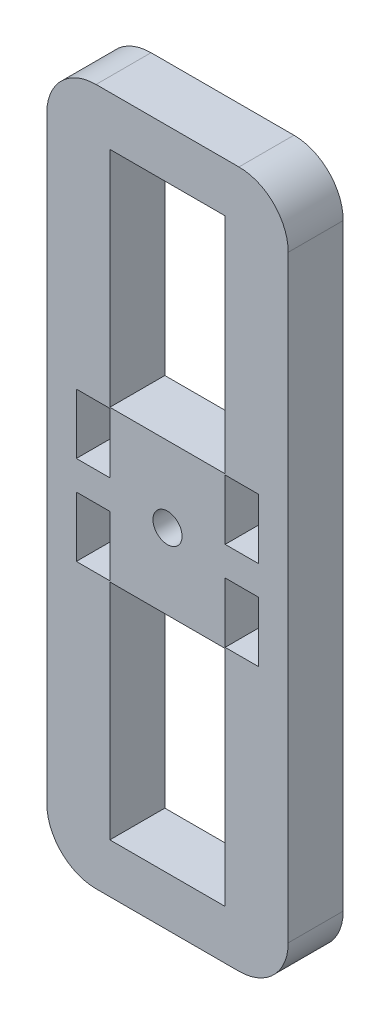
from build123d import *

# Parameters (mm, degrees)
SKETCH1_W           = 11.7
SKETCH1_H           = 22.669491249
SKETCH1_W_2         = 3.4
SKETCH1_H_2         = 6.1
SKETCH1_R           = 1.475
SKETCH1_H_3         = 22.669491248
BOSS_EXTRUDE1_DEPTH = 5.58


with BuildPart() as part:
    # Sketch1 → Boss-Extrude1 (new body)
    with BuildSketch(Plane.XY):
        with BuildLine():
            Line((708.445729089, 432.610180658), (715.695729089, 432.610180658))
            Line((715.695729089, 432.610180658), (722.945729089, 432.610180658))
            ThreePointArc((722.945729089, 432.610180658), (726.481262995, 434.074646752), (727.945729089, 437.610180658))
            Line((727.945729089, 437.610180658), (727.945729089, 498.299163155))
            ThreePointArc((727.945729089, 498.299163155), (726.481262995, 501.834697061), (722.945729089, 503.299163155))
            Line((722.945729089, 503.299163155), (715.695729089, 503.299163155))
            Line((715.695729089, 503.299163155), (708.445729089, 503.299163155))
            ThreePointArc((708.445729089, 503.299163155), (704.910195183, 501.834697061), (703.445729089, 498.299163155))
            Line((703.445729089, 498.299163155), (703.445729089, 437.610180658))
            ThreePointArc((703.445729089, 437.610180658), (704.910195183, 434.074646752), (708.445729089, 432.610180658))
        make_face()
        with Locations((715.695729089, 448.944926283)):
            Rectangle(SKETCH1_W, SKETCH1_H, mode=Mode.SUBTRACT)
        with Locations((708.145729089, 463.429671907)):
            Rectangle(SKETCH1_W_2, SKETCH1_H_2, mode=Mode.SUBTRACT)
        with Locations((715.695729089, 467.954671907)):
            Circle(SKETCH1_R, mode=Mode.SUBTRACT)
        with Locations((723.245729089, 463.429671907)):
            Rectangle(SKETCH1_W_2, SKETCH1_H_2, mode=Mode.SUBTRACT)
        with Locations((708.145729089, 472.479671907)):
            Rectangle(SKETCH1_W_2, SKETCH1_H_2, mode=Mode.SUBTRACT)
        with Locations((715.695729089, 486.964417531)):
            Rectangle(SKETCH1_W, SKETCH1_H_3, mode=Mode.SUBTRACT)
        with Locations((723.245729089, 472.479671907)):
            Rectangle(SKETCH1_W_2, SKETCH1_H_2, mode=Mode.SUBTRACT)
    extrude(amount=BOSS_EXTRUDE1_DEPTH)


solid = part.part
